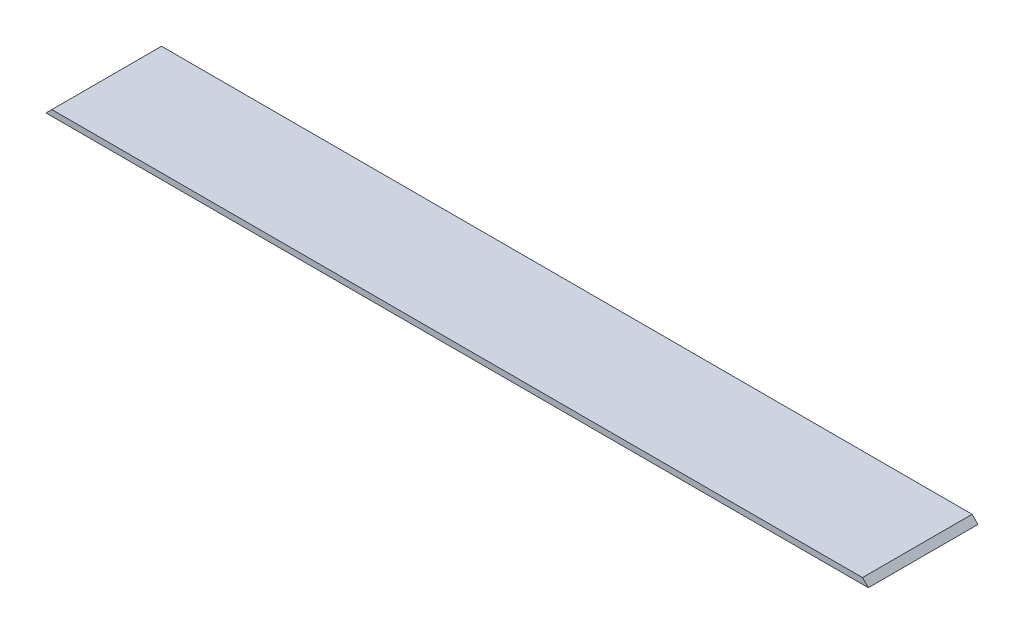
from build123d import *

# Parameters (mm, degrees)
SKETCH1_W           = 2667
SKETCH1_H           = 355.6
BOSS_EXTRUDE1_DEPTH = 9.525
CHAMFER1_SIZE       = 19.05


with BuildPart() as part:
    # Sketch1 → Boss-Extrude1 (new, symmetric)
    with BuildSketch(Plane(origin=(0, 0, 0), x_dir=(1, 0, 0), z_dir=(0, 1, 0))):
        Rectangle(SKETCH1_W, SKETCH1_H)
    extrude(amount=BOSS_EXTRUDE1_DEPTH, both=True)

    # Chamfer1
    chamfer1_edges = [part.edges().sort_by_distance(p)[0] for p in [
        (1333.5, 9.525, 0),
        (-1333.5, 9.525, 0),
    ]]
    chamfer(chamfer1_edges, length=CHAMFER1_SIZE - 0.0001)  # a hair under: the kernel refuses the full size


solid = part.part
